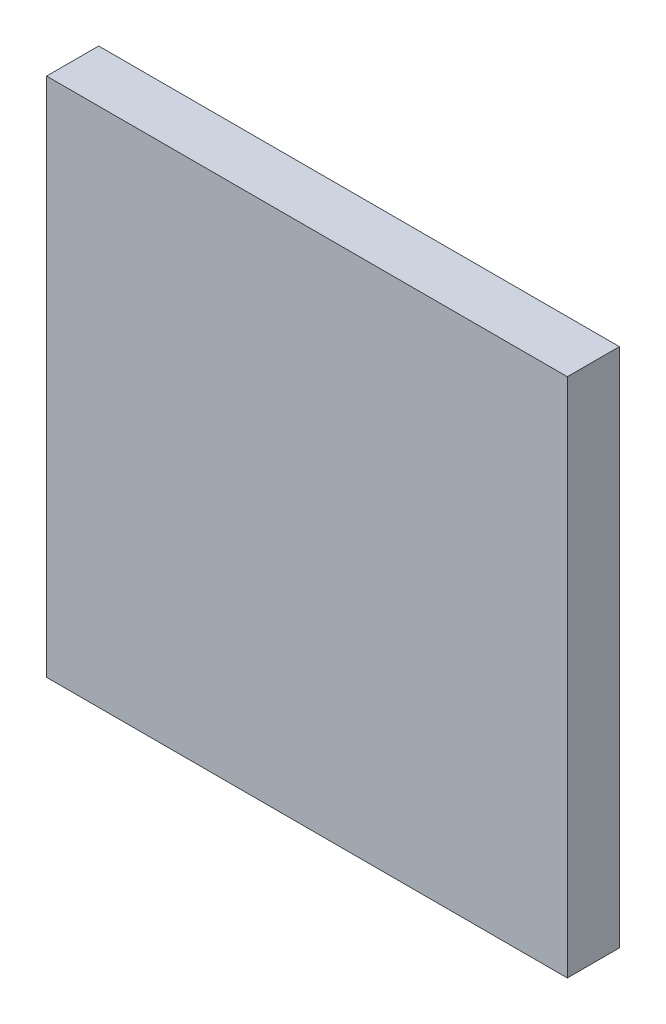
from build123d import *

# Parameters (mm, degrees)
IZIM1_W            = 200
IZIM1_H            = 200
TABAN_FLAN_1_DEPTH = 20


# Sheet-metal steps are written as plain solids
with BuildPart() as part:
    # Çizim1 → Taban-Flanş1 (new body)
    with BuildSketch(Plane.XY):
        with Locations((100, -100)):
            Rectangle(IZIM1_W, IZIM1_H)
    extrude(amount=-TABAN_FLAN_1_DEPTH)


solid = part.part
